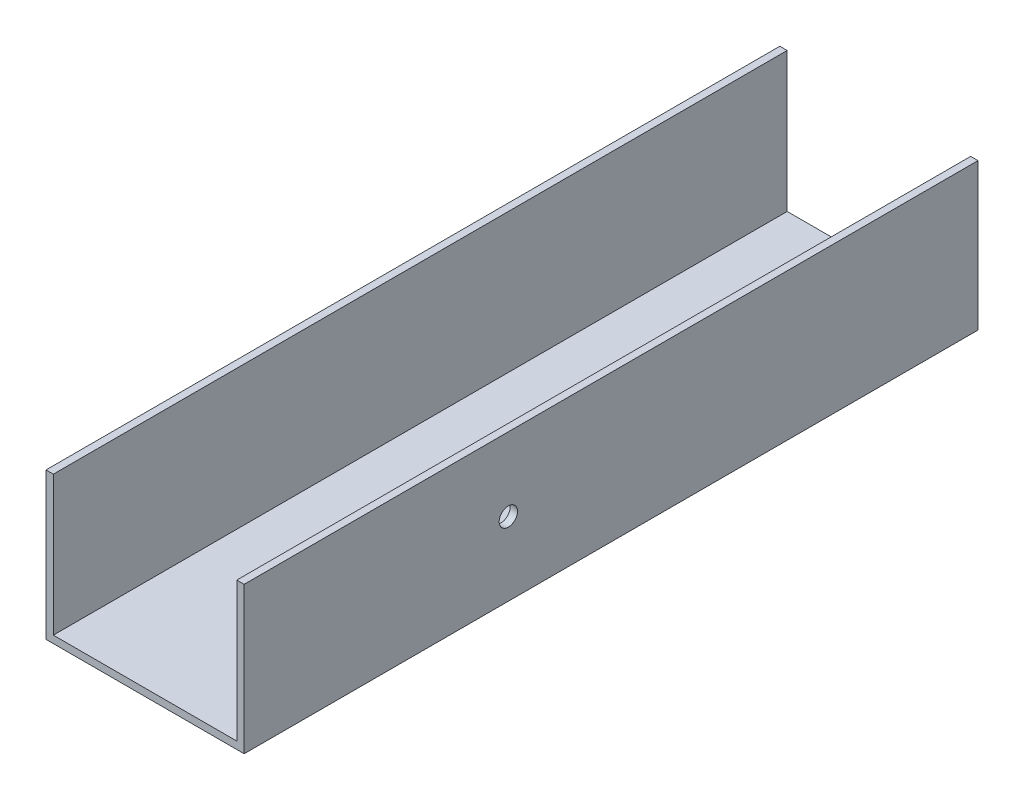
from build123d import *

# Parameters (mm, degrees)
SALIENTE_EXTRUIR1_DEPTH = 100
CROQUIS2_R              = 2.5
CORTAR_EXTRUIR1_DEPTH   = 10


with BuildPart() as part:
    # Croquis1 → Saliente-Extruir1 (new, symmetric)
    with BuildSketch(Plane.XY):
        Polygon((-25, 20), (-27, 20), (-27, -20), (27, -20), (27, 20), (25, 20), (25, -18), (-25, -18), align=None)
    extrude(amount=SALIENTE_EXTRUIR1_DEPTH, both=True)

    # Croquis2 → Cortar-Extruir1 (cut)
    with BuildSketch(Plane(origin=(27, 0, 0), x_dir=(0, 0, -1), z_dir=(1, 0, 0))):
        with Locations((-28, 0)):
            Circle(CROQUIS2_R)
    extrude(amount=-CORTAR_EXTRUIR1_DEPTH, mode=Mode.SUBTRACT)


solid = part.part
